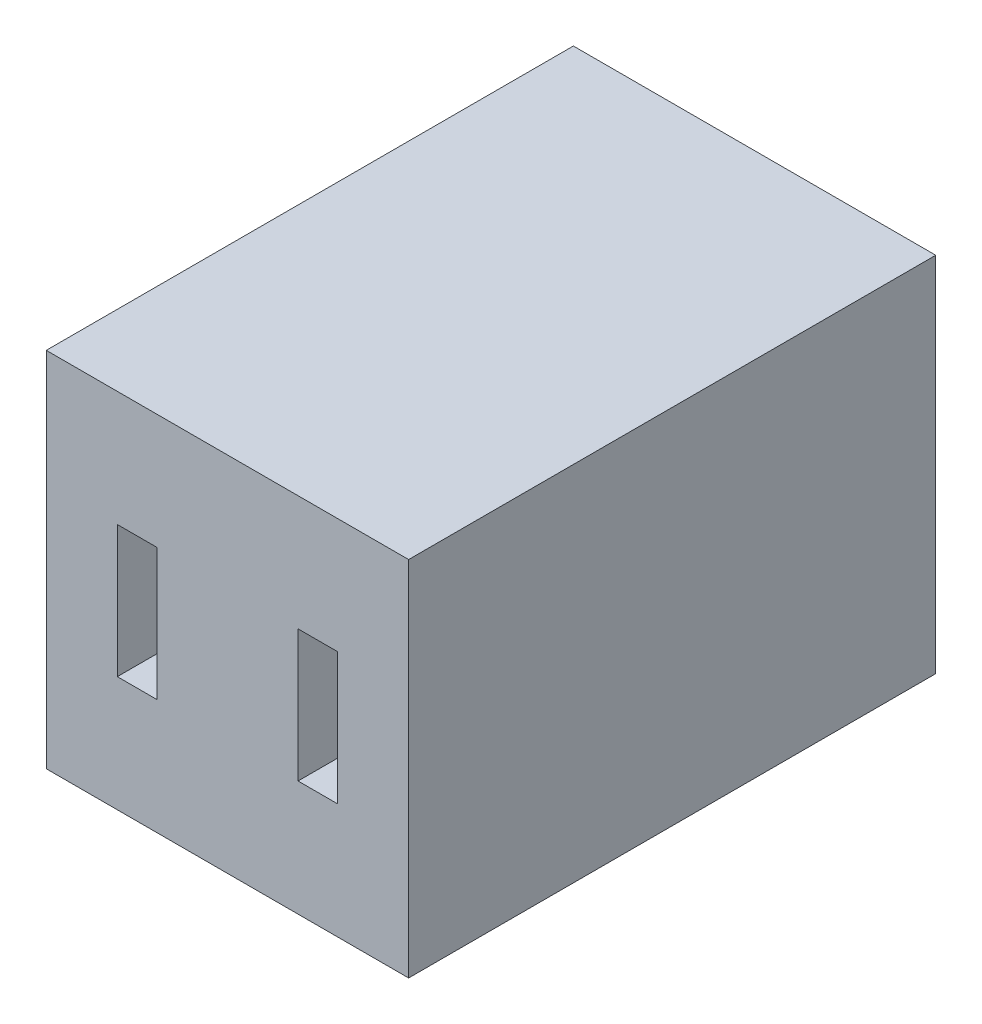
from build123d import *

# Parameters (mm, degrees)
SKETCH1_W           = 27.5
SKETCH1_H           = 27.5
BOSS_EXTRUDE1_DEPTH = 40
SKETCH2_W           = 3
SKETCH2_H           = 10
CUT_EXTRUDE1_DEPTH  = 45.476117187


with BuildPart() as part:
    # Sketch1 → Boss-Extrude1 (new body)
    with BuildSketch(Plane(origin=(0, 0, 0), x_dir=(0, 1, 0), z_dir=(0, 0, 1))):
        Rectangle(SKETCH1_W, SKETCH1_H)
    extrude(amount=BOSS_EXTRUDE1_DEPTH)

    # Sketch2 → Cut-Extrude1 (cut, through all)
    with BuildSketch(Plane.XY.offset(40)):
        with Locations((6.857564012, 0)):
            Rectangle(SKETCH2_W, SKETCH2_H)
        with Locations((-6.857564012, 0)):
            Rectangle(SKETCH2_W, SKETCH2_H)
    extrude(amount=-CUT_EXTRUDE1_DEPTH, mode=Mode.SUBTRACT)


solid = part.part
